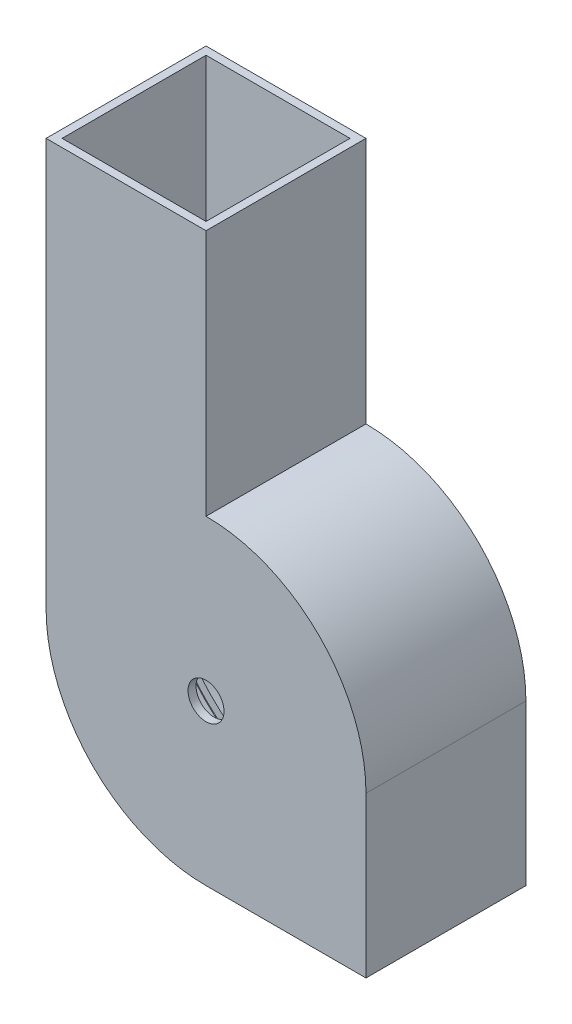
from build123d import *

# Parameters (mm, degrees)
BOSS_EXTRUDE1_DEPTH      = 40
SHELL1_T                 = -2
SKETCH2_W                = 36
SKETCH2_H                = 36
CUT_EXTRUDE1_DEPTH       = 40
SKETCH7_R                = 11
BOSS_EXTRUDE3_DEPTH      = 2
CUT_EXTRUDE4_REACH       = 120.704
SKETCH8_R                = 4.5
BOSS_EXTRUDE4_START      = -2
SKETCH9_R                = 11
BOSS_EXTRUDE4_DEPTH      = 2
SKETCH10_R               = 4.5
CUT_EXTRUDE5_DEPTH       = 119.70397032
CUT_EXTRUDE7_DEPTH       = 116
SKETCH13_W               = 17.903702302
SKETCH13_H               = 6.311893405
BOSS_EXTRUDE5_DEPTH      = 2
BOSS_EXTRUDE6_START      = -2
SKETCH14_W               = 14.653381942
SKETCH14_H               = 6.179386425
BOSS_EXTRUDE6_DEPTH      = 2
BOSS_EXTRUDE7_DEPTH      = 90
SKETCH16_W               = 35
SKETCH16_H               = 35
SKETCH16_W_2             = 32
SKETCH16_H_2             = 32
BOSS_EXTRUDE8_DEPTH      = 10
SPLIT2_START             = 101.855940277
SPLIT2_OUTLINE_W         = 35
SPLIT2_OUTLINE_H         = 35
SPLIT2_OUTLINE_W_2       = 32
SPLIT2_OUTLINE_H_2       = 32
SPLIT2_DEPTH             = 10
CUT_EXTRUDE10_DEPTH      = 10
CUT_EXTRUDE11_REACH      = 154.719
CUT_EXTRUDE11_END_RADIUS = 38


# Read off the part's stored shape, not the designer's step: Split2
with BuildPart() as part:
    # Sketch1 → Boss-Extrude1 (new body)
    with BuildSketch(Plane.XY):
        with BuildLine():
            Line((-40, 0), (-40, 101.855940277))
            Line((-40, 101.855940277), (0, 101.855940277))
            Line((0, 101.855940277), (0, 40))
            ThreePointArc((0, 40), (28.284271247, 28.284271247), (40, 0))
            Line((40, 0), (40, -40))
            Line((40, -40), (0, -40))
            ThreePointArc((0, -40), (-28.284271247, -28.284271247), (-40, 0))
        make_face()
    extrude(amount=BOSS_EXTRUDE1_DEPTH)

    # Shell1
    shell1_openings = [part.faces().sort_by_distance(p)[0] for p in [
        (-20, 101.855940277, 20),
    ]]
    offset(amount=SHELL1_T, openings=shell1_openings, kind=Kind.INTERSECTION)

    # Sketch2 → Cut-Extrude1 (cut)
    with BuildSketch(Plane.XZ.offset(40)):
        with Locations((20, 20)):
            Rectangle(SKETCH2_W, SKETCH2_H)
    extrude(amount=-CUT_EXTRUDE1_DEPTH, mode=Mode.SUBTRACT)

    # Sketch7 → Boss-Extrude3 (add)
    with BuildSketch(Plane.XY.offset(40)):
        with Locations((35, -40)):
            Circle(SKETCH7_R)
    extrude(amount=-BOSS_EXTRUDE3_DEPTH)

    # Cut-Extrude4: up to this face of the body (flat: up to its plane)
    cut_extrude4_end = Plane(part.part.faces().sort_by_distance((-6.043930541, 21.434186246, 0))[0])
    # Sketch8 → Cut-Extrude4 (cut, up to the picked face)
    with BuildSketch(Plane.XY.offset(40), mode=Mode.PRIVATE) as cut_extrude4_sk1:
        Circle(SKETCH8_R)
    cut_extrude4_tool1 = split(extrude(cut_extrude4_sk1.sketch, amount=-CUT_EXTRUDE4_REACH, mode=Mode.PRIVATE), bisect_by=cut_extrude4_end, keep=Keep.BOTH, mode=Mode.PRIVATE)
    add(cut_extrude4_tool1.solids().sort_by(Axis((0, 0, 40), (0, 0, -1)))[0], mode=Mode.SUBTRACT)

    # Sketch9 → Boss-Extrude4 (add)
    with BuildSketch(Plane(origin=(0, 0, 0), x_dir=(-1, 0, 0), z_dir=(0, 0, -1)).offset(BOSS_EXTRUDE4_START)):
        with Locations((-35, -40)):
            Circle(SKETCH9_R)
    extrude(amount=BOSS_EXTRUDE4_DEPTH)

    # Sketch10 → Cut-Extrude5 (cut, through all)
    with BuildSketch(Plane.XY.offset(40)):
        with Locations((35, -40)):
            Circle(SKETCH10_R)
    extrude(amount=-CUT_EXTRUDE5_DEPTH, mode=Mode.SUBTRACT)

    # Sketch12 → Cut-Extrude7 (cut)
    with BuildSketch(Plane.XY.offset(40)):
        Polygon((18.9138728, -40), (40, -40), (40, -27.471938066), (78.618333512, -27.471938066), (78.618333512, -62.153205685), (18.9138728, -62.153205685), align=None)
    extrude(amount=-CUT_EXTRUDE7_DEPTH, mode=Mode.SUBTRACT)

    # Sketch13 → Boss-Extrude5 (add)
    with BuildSketch(Plane.XY.offset(40)):
        with Locations((31.048148849, -36.844053297)):
            Rectangle(SKETCH13_W, SKETCH13_H)
    extrude(amount=-BOSS_EXTRUDE5_DEPTH)

    # Sketch14 → Boss-Extrude6 (add)
    with BuildSketch(Plane(origin=(0, 0, 0), x_dir=(-1, 0, 0), z_dir=(0, 0, -1)).offset(BOSS_EXTRUDE6_START)):
        with Locations((-32.673309029, -36.910306788)):
            Rectangle(SKETCH14_W, SKETCH14_H)
    extrude(amount=BOSS_EXTRUDE6_DEPTH)

    # Sketch15 → Boss-Extrude7 (add)
    with BuildSketch(Plane.XY.offset(40)):
        with BuildLine():
            Line((-28.5, 40), (15, 40))
            ThreePointArc((15, 40), (32.67766953, 32.67766953), (40, 15))
            Line((40, 15), (40, -15))
            Line((40, -15), (40, -25))
            ThreePointArc((40, -25), (38.535533906, -28.535533906), (35, -30))
            Line((35, -30), (-33.5, -30))
            ThreePointArc((-33.5, -30), (-37.035533906, -31.464466094), (-38.5, -35))
            Line((-38.5, -35), (-38.5, -40))
            Line((-38.5, -40), (-40, -40))
            Line((-40, -40), (-40, 40))
            Line((-40, 40), (-40, 60))
            Line((-40, 60), (-38.5, 60))
            Line((-38.5, 60), (-38.5, 50))
            ThreePointArc((-38.5, 50), (-35.571067812, 42.928932188), (-28.5, 40))
        make_face()
    extrude(amount=BOSS_EXTRUDE7_DEPTH)

    # Split1
    split(bisect_by=Plane.XY.offset(40), keep=Keep.BOTTOM)

    # Sketch19 → Cut-Extrude10 (cut)
    with BuildSketch(Plane.XZ.offset(40)):
        with BuildLine():
            Line((-1, 36), (-1, 4))
            ThreePointArc((-1, 4), (-2, 3), (-3, 4))
            Line((-3, 4), (-3, 36))
            ThreePointArc((-3, 36), (-2, 37), (-1, 36))
        make_face()
    extrude(amount=-CUT_EXTRUDE10_DEPTH, mode=Mode.SUBTRACT)

    # Cut-Extrude11: up to this cylinder (the profile starts outside it)
    cut_extrude11_end = Plane(origin=(0, 0, 20), z_dir=(0, 0, -1)) * Cylinder(CUT_EXTRUDE11_END_RADIUS, 418.838, mode=Mode.PRIVATE)
    # Sketch20 → Cut-Extrude11 (cut, up to the surface)
    with BuildSketch(Plane.XZ.offset(40), mode=Mode.PRIVATE) as cut_extrude11_sk1:
        with BuildLine():
            Line((-35.5, 4.6), (-5.5, 4.6))
            ThreePointArc((-5.5, 4.6), (-4.7, 3.8), (-5.5, 3))
            Line((-5.5, 3), (-35.5, 3))
            ThreePointArc((-35.5, 3), (-36.3, 3.8), (-35.5, 4.6))
        make_face()
    cut_extrude11_tool1 = extrude(cut_extrude11_sk1.sketch, amount=-CUT_EXTRUDE11_REACH, mode=Mode.PRIVATE) - cut_extrude11_end
    add(cut_extrude11_tool1.solids().sort_by_distance((-20.5, -40, 3.8))[0], mode=Mode.SUBTRACT)
    # Sketch20 → Cut-Extrude11 (cut, up to the surface)
    with BuildSketch(Plane.XZ.offset(40), mode=Mode.PRIVATE) as cut_extrude11_sk2:
        with BuildLine():
            Line((-35.5, 13.2), (-5.5, 13.2))
            ThreePointArc((-5.5, 13.2), (-4.7, 12.4), (-5.5, 11.6))
            Line((-5.5, 11.6), (-35.5, 11.6))
            ThreePointArc((-35.5, 11.6), (-36.3, 12.4), (-35.5, 13.2))
        make_face()
    cut_extrude11_tool2 = extrude(cut_extrude11_sk2.sketch, amount=-CUT_EXTRUDE11_REACH, mode=Mode.PRIVATE) - cut_extrude11_end
    add(cut_extrude11_tool2.solids().sort_by_distance((-20.5, -40, 12.4))[0], mode=Mode.SUBTRACT)
    # Sketch20 → Cut-Extrude11 (cut, up to the surface)
    with BuildSketch(Plane.XZ.offset(40), mode=Mode.PRIVATE) as cut_extrude11_sk3:
        with BuildLine():
            Line((-35.5, 20.8), (-5.5, 20.8))
            ThreePointArc((-5.5, 20.8), (-4.7, 20), (-5.5, 19.2))
            Line((-5.5, 19.2), (-35.5, 19.2))
            ThreePointArc((-35.5, 19.2), (-36.3, 20), (-35.5, 20.8))
        make_face()
    cut_extrude11_tool3 = extrude(cut_extrude11_sk3.sketch, amount=-CUT_EXTRUDE11_REACH, mode=Mode.PRIVATE) - cut_extrude11_end
    add(cut_extrude11_tool3.solids().sort_by_distance((-20.5, -40, 20))[0], mode=Mode.SUBTRACT)
    # Sketch20 → Cut-Extrude11 (cut, up to the surface)
    with BuildSketch(Plane.XZ.offset(40), mode=Mode.PRIVATE) as cut_extrude11_sk4:
        with BuildLine():
            Line((-35.5, 28.4), (-5.5, 28.4))
            ThreePointArc((-5.5, 28.4), (-4.7, 27.6), (-5.5, 26.8))
            Line((-5.5, 26.8), (-35.5, 26.8))
            ThreePointArc((-35.5, 26.8), (-36.3, 27.6), (-35.5, 28.4))
        make_face()
    cut_extrude11_tool4 = extrude(cut_extrude11_sk4.sketch, amount=-CUT_EXTRUDE11_REACH, mode=Mode.PRIVATE) - cut_extrude11_end
    add(cut_extrude11_tool4.solids().sort_by_distance((-20.5, -40, 27.6))[0], mode=Mode.SUBTRACT)
    # Sketch20 → Cut-Extrude11 (cut, up to the surface)
    with BuildSketch(Plane.XZ.offset(40), mode=Mode.PRIVATE) as cut_extrude11_sk5:
        with BuildLine():
            Line((-35.5, 37), (-5.5, 37))
            ThreePointArc((-5.5, 37), (-4.7, 36.2), (-5.5, 35.4))
            Line((-5.5, 35.4), (-35.5, 35.4))
            ThreePointArc((-35.5, 35.4), (-36.3, 36.2), (-35.5, 37))
        make_face()
    cut_extrude11_tool5 = extrude(cut_extrude11_sk5.sketch, amount=-CUT_EXTRUDE11_REACH, mode=Mode.PRIVATE) - cut_extrude11_end
    add(cut_extrude11_tool5.solids().sort_by_distance((-20.5, -40, 36.2))[0], mode=Mode.SUBTRACT)


with BuildPart() as body_2:
    # Sketch16 → Boss-Extrude8 (new body)
    with BuildSketch(Plane(origin=(0, 101.855940277, 0), x_dir=(1, 0, 0), z_dir=(0, 1, 0))):
        with Locations((-20, -20)):
            Rectangle(SKETCH16_W, SKETCH16_H)
        with Locations((-20, -20)):
            Rectangle(SKETCH16_W_2, SKETCH16_H_2, mode=Mode.SUBTRACT)
    extrude(amount=BOSS_EXTRUDE8_DEPTH)

    # Split2 outline → Split2 (cut)
    with BuildSketch(Plane(origin=(0, 0, 0), x_dir=(1, 0, 0), z_dir=(0, 1, 0)).offset(SPLIT2_START)):
        with Locations((-20, -20)):
            Rectangle(SPLIT2_OUTLINE_W, SPLIT2_OUTLINE_H)
        with Locations((-20, -20)):
            Rectangle(SPLIT2_OUTLINE_W_2, SPLIT2_OUTLINE_H_2, mode=Mode.SUBTRACT)
    extrude(amount=SPLIT2_DEPTH, mode=Mode.SUBTRACT)


solid = part.part
